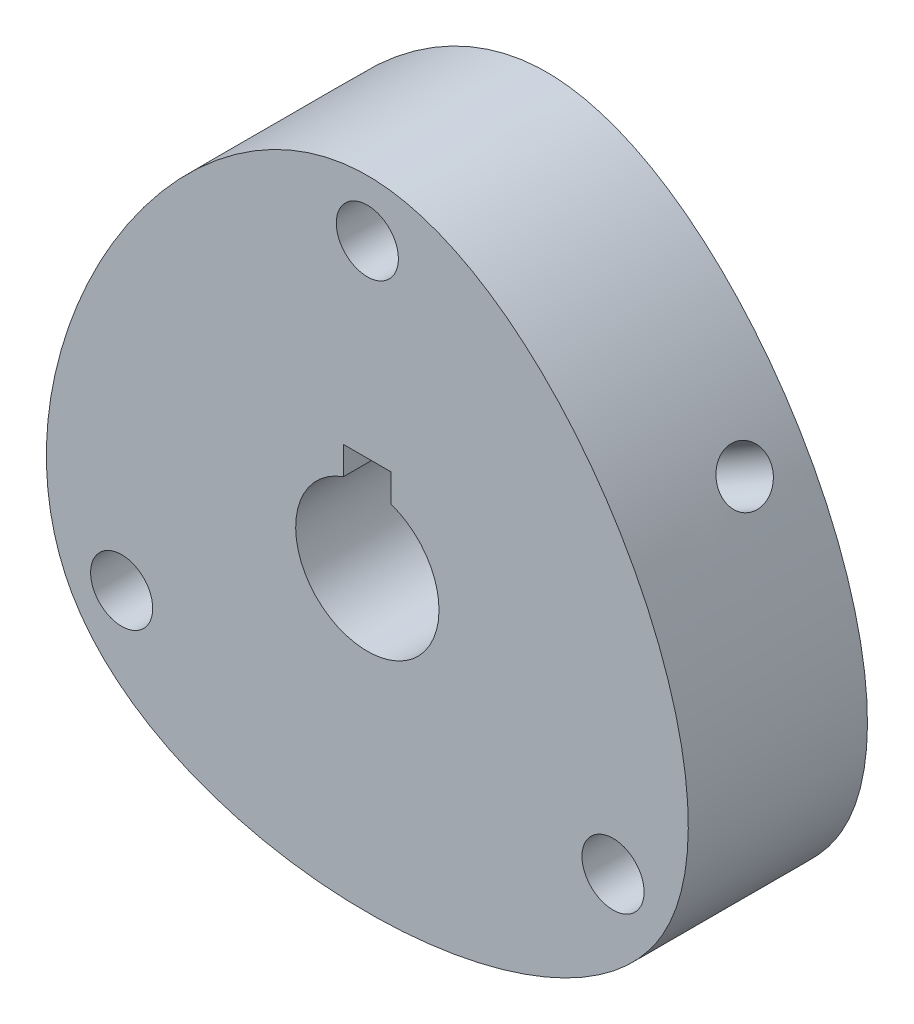
from build123d import *

# Parameters (mm, degrees)
SKETCH_1_R           = 2.6
EXTRUDE_1_DEPTH      = 15
SKETCH_13_R          = 2.15
CUT_EXTRUDE_10_DEPTH = 42.943414433
SKETCH_14_R          = 2.15
CUT_EXTRUDE_11_DEPTH = 42.943414433
SKETCH_15_R          = 4.1
CUT_EXTRUDE_12_DEPTH = 5.2


with BuildPart() as part:
    # ｽｹｯﾁ1 → ﾎﾞｽ - 押し出し1 (new body)
    with BuildSketch(Plane.XY):
        with BuildLine():
            add(Edge.make_bspline(
                [(24.681724008, -14.25), (32.908965344, 0), (-1.1e-08, 56.999999981), (-49.363447804, -28.499999633), (16.454482294, -28.500000089), (24.681724008, -14.25)],
                knots=[0, 0, 0, 0, 0.333333333, 0.666666668, 0.999999999, 0.999999999, 0.999999999, 0.999999999], degree=3))
        make_face()
        with Locations((-20.56810334, -11.875)):
            Circle(SKETCH_1_R, mode=Mode.SUBTRACT)
        with BuildLine():
            Line((-2, 5.656854249), (-2, 8))
            Line((-2, 8), (2, 8))
            Line((2, 8), (2, 5.656854249))
            ThreePointArc((2, 5.656854249), (0, -6), (-2, 5.656854249))
        make_face(mode=Mode.SUBTRACT)
        with Locations((0, 23.75)):
            Circle(SKETCH_1_R, mode=Mode.SUBTRACT)
        with Locations((20.56810334, -11.875)):
            Circle(SKETCH_1_R, mode=Mode.SUBTRACT)
    extrude(amount=EXTRUDE_1_DEPTH)

    # ｽｹｯﾁ13 → ｶｯﾄ - 押し出し10 (cut, through all)
    with BuildSketch(Plane(origin=(0, 0, 0), x_dir=(1, 0, 0), z_dir=(0, 1, 0))):
        with Locations((0, -5)):
            Circle(SKETCH_13_R)
    extrude(amount=-CUT_EXTRUDE_10_DEPTH, mode=Mode.SUBTRACT)

    # ｽｹｯﾁ14 → ｶｯﾄ - 押し出し11 (cut, through all)
    with BuildSketch(Plane(origin=(0, 0, 0), x_dir=(0, 0, 1), z_dir=(-0.8660254037844364, -0.5000000000000041, 0))):
        with Locations((5, 0)):
            Circle(SKETCH_14_R)
    extrude(amount=-CUT_EXTRUDE_11_DEPTH, mode=Mode.SUBTRACT)

    # ｽｹｯﾁ15 → ｶｯﾄ - 押し出し12 (cut)
    with BuildSketch(Plane(origin=(0, 0, 0), x_dir=(-1, 0, 0), z_dir=(0, 0, -1))):
        with Locations((-20.56810334, -11.875)):
            Circle(SKETCH_15_R)
        with Locations((0, 23.75)):
            Circle(SKETCH_15_R)
        with Locations((20.56810334, -11.875)):
            Circle(SKETCH_15_R)
    extrude(amount=-CUT_EXTRUDE_12_DEPTH, mode=Mode.SUBTRACT)


solid = part.part
